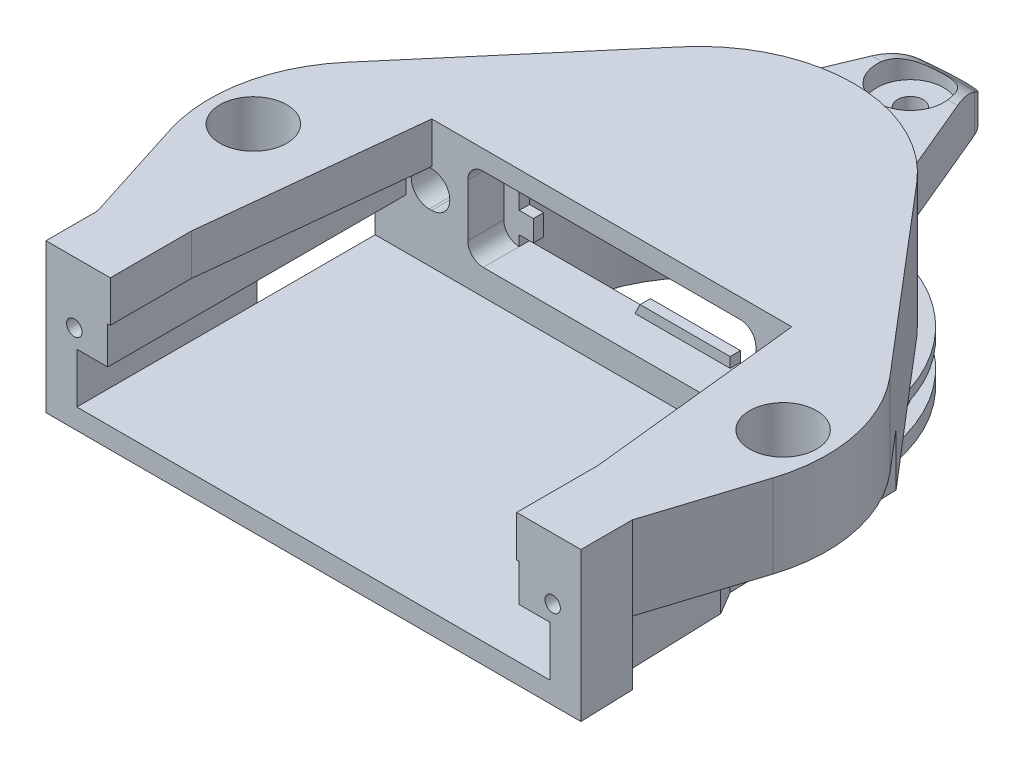
from build123d import *

# Parameters (mm, degrees)
TOP_SIDE_R                   = 0.5
BASE_MODEL_DEPTH             = 0.5
BOSS_EXTRUDE1_DEPTH          = 15
BOSS_EXTRUDE2_DEPTH          = 75
BOSS_EXTRUDE2_DEPTH_BACK     = 20
SKETCH9_W                    = 120
SKETCH9_H                    = 26
F_5_0_5_DIAMETER_HOLE1_D     = 5
CUT_EXTRUDE1_START           = 2.55
CUT_EXTRUDE1_DEPTH           = 21.3
CUT_EXTRUDE2_DEPTH           = 98.85991263
CUT_EXTRUDE2_DEPTH_BACK      = 9.8
CUT_EXTRUDE2_START           = 2.55
DRAFT11_START                = -48.5
DRAFT11_DEPTH                = 97
DRAFT11_START_2              = -52
DRAFT11_2_DEPTH              = 104
DRAFT11_START_3              = -9.867171929
DRAFT11_3_DEPTH              = 2.617171929
CUT_EXTRUDE5_START           = -18.75
CUT_EXTRUDE5_DEPTH           = 36
FILLET2_R                    = 10
CUT_EXTRUDE3_START           = 13.25
SKETCH12_R                   = 6.5
CUT_EXTRUDE3_DEPTH           = 4
CUT_EXTRUDE4_START           = 7.55
SKETCH14_R                   = 6.5
CUT_EXTRUDE4_DEPTH           = 11.2
CUT_EXTRUDE6_START           = -6.25
CUT_EXTRUDE6_DEPTH           = 25
CUT_EXTRUDE7_DEPTH           = 98.85991263
CUT_EXTRUDE7_DEPTH_BACK      = 7
CUT_EXTRUDE7_START           = 17
CUT_EXTRUDE8_START           = 17
CUT_EXTRUDE8_DEPTH           = 81.85991263
CUT_EXTRUDE9_START           = 8
CUT_EXTRUDE9_DEPTH           = 90.85991263
F_3_0_3_DIAMETER_HOLE1_D     = 3
F_3_0_3_DIAMETER_HOLE1_DEPTH = 15
F_3_0_3_DIAMETER_HOLE1_TIP   = 0.901290929


with BuildPart() as part:
    # Top Side → Base Model (new, symmetric)
    with BuildSketch(Plane(origin=(0, 0, 0), x_dir=(1, 0, 0), z_dir=(0, 1, 0))):
        with Locations(Location((0, 0, 0), (0, 0, 270))):
            Circle(TOP_SIDE_R)
    extrude(amount=BASE_MODEL_DEPTH, both=True)



with BuildPart() as body_2:
    # Sketch3 → Base (revolve)
    with BuildSketch(Plane(origin=(0, 0, 0), x_dir=(0, 0, -1), z_dir=(1, 0, 0))):
        Polygon((0, -18.75), (30, -18.75), (31.25, -17.25), (32.5, -17.25), (32.5, -14.25), (30, -14.25), (30, -9.25), (32.5, -9.25), (32.5, -7.25), (30, -7.25), (30, 18.75), (0, 18.75), align=None)
    revolve(axis=Axis((0, -18.75, 0), (0, 1, 0)))

    # Sketch8 → Boss-Extrude1 (add, symmetric)
    with BuildSketch(Plane(origin=(0, 0, 0), x_dir=(0, 0, -1), z_dir=(1, 0, 0))):
        Polygon((0, 4.25), (51.5, 4.25), (51.5, 8.25), (45.5, 13.25), (0, 13.25), align=None)
    extrude(amount=BOSS_EXTRUDE1_DEPTH, both=True)


with BuildPart() as part_1:
    add(part.part)

    add(body_2.part)  # Boss-Extrude2 merges body 2
    # Sketch9 → Boss-Extrude2 (add, two sides: drawn at the far end of the back side and taken through both)
    with BuildSketch(Plane.XY.offset(-BOSS_EXTRUDE2_DEPTH_BACK)):
        with Locations((0, 5.75)):
            Rectangle(SKETCH9_W, SKETCH9_H)
    extrude(amount=BOSS_EXTRUDE2_DEPTH + BOSS_EXTRUDE2_DEPTH_BACK)

    # Ø5.0 (5) Diameter Hole1 (through all)
    with Locations(Plane(origin=(0, 18.75, 0), x_dir=(1, 0, 0), z_dir=(0, 1, 0))):
        with Locations((-51.5, -35.2), (0, 41.034834557), (51.5, -35.2)):
            Hole(F_5_0_5_DIAMETER_HOLE1_D / 2)

    # Bottom Side Sketch5 → Cut-Extrude1 (cut)
    with BuildSketch(Plane(origin=(0, 0, 0), x_dir=(1, 0, 0), z_dir=(0, 1, 0)).offset(CUT_EXTRUDE1_START)):
        with BuildLine():
            Line((-25.617376915, 20), (-46, -6.107466904))
            Line((-46, -6.107466904), (-46, -40))
            Line((-46, -40), (-48.5, -44.330127019))
            Line((-48.5, -44.330127019), (-48.5, -65))
            Line((-48.5, -65), (-52, -65))
            Line((-52, -65), (-52, -116.5))
            Line((-52, -116.5), (-101.5, -116.5))
            Line((-101.5, -116.5), (-101.5, 101.5))
            Line((-101.5, 101.5), (101.5, 101.5))
            Line((101.5, 101.5), (101.5, -116.5))
            Line((101.5, -116.5), (52, -116.5))
            Line((52, -116.5), (52, -65))
            Line((52, -65), (48.5, -65))
            Line((48.5, -65), (48.5, -44.330127019))
            Line((48.5, -44.330127019), (46, -40))
            Line((46, -40), (46, -6.107466904))
            Line((46, -6.107466904), (25.617376915, 20))
            ThreePointArc((25.617376915, 20), (0, 32.5), (-25.617376915, 20))
        make_face()
    extrude(amount=-CUT_EXTRUDE1_DEPTH, mode=Mode.SUBTRACT)

    # Sketch11 → Cut-Extrude2 (cut, two sides: drawn at the far end of the back side and taken through both)
    with BuildSketch(Plane(origin=(0, 0, 0), x_dir=(1, 0, 0), z_dir=(0, 1, 0)).offset(CUT_EXTRUDE2_START - CUT_EXTRUDE2_DEPTH_BACK)):
        with BuildLine():
            Line((-52, -116.5), (-52, -65))
            Line((-52, -65), (-58.587704801, -44.296325315))
            ThreePointArc((-58.587704801, -44.296325315), (-59.408678786, -29.272976119), (-52.832552516, -15.740438196))
            Line((-52.832552516, -15.740438196), (-22.832552516, 19.459561804))
            ThreePointArc((-22.832552516, 19.459561804), (-19.195234326, 23.055215877), (-15, 25.980762114))
            Line((-15, 25.980762114), (-5.996666068, 47.507986456))
            ThreePointArc((-5.996666068, 47.507986456), (0, 51.5), (5.996666068, 47.507986456))
            Line((5.996666068, 47.507986456), (15, 25.980762114))
            ThreePointArc((15, 25.980762114), (19.195234326, 23.055215877), (22.832552516, 19.459561804))
            Line((22.832552516, 19.459561804), (52.832552516, -15.740438196))
            ThreePointArc((52.832552516, -15.740438196), (59.408678786, -29.272976119), (58.587704801, -44.296325315))
            Line((58.587704801, -44.296325315), (52, -65))
            Line((52, -65), (52, -116.5))
            Line((52, -116.5), (101.5, -116.5))
            Line((101.5, -116.5), (101.5, 101.5))
            Line((101.5, 101.5), (-101.5, 101.5))
            Line((-101.5, 101.5), (-101.5, -116.5))
            Line((-101.5, -116.5), (-52, -116.5))
        make_face()
    extrude(amount=CUT_EXTRUDE2_DEPTH + CUT_EXTRUDE2_DEPTH_BACK, mode=Mode.SUBTRACT)

    # Draft11: read off the stored shape, not the designer's step
    # Draft11 outline → Draft11 (add)
    with BuildSketch(Plane.YZ.offset(DRAFT11_START)):
        Polygon((-7.25, 75), (-10.216379624, 75), (-7.25, -9.945998255), align=None)
    extrude(amount=DRAFT11_DEPTH)

    # Draft11 2 outline → Draft11 2 (add)
    with BuildSketch(Plane.YZ.offset(DRAFT11_START_2)):
        Polygon((-7.25, 75), (-10.216379624, 75), (-9.867171929, 65), (-7.25, 65), align=None)
    extrude(amount=DRAFT11_2_DEPTH)

    # Draft11 3 outline → Draft11 3 (cut)
    with BuildSketch(Plane(origin=(0, 0, 0), x_dir=(1, 0, 0), z_dir=(0, 1, 0)).offset(DRAFT11_START_3)):
        Polygon((48.5, 9.945998255), (30.940703268, 9.945998255), (46, -7.723576577), (46, -40), (48.5, -44.330127019), align=None)
        Polygon((-30.940703268, 9.945998255), (-48.5, 9.945998255), (-48.5, -44.330127019), (-46, -40), (-46, -7.723576577), align=None)
    extrude(amount=DRAFT11_3_DEPTH, mode=Mode.SUBTRACT)

    # Sketch16 → Cut-Extrude5 (cut)
    with BuildSketch(Plane(origin=(0, 0, 0), x_dir=(1, 0, 0), z_dir=(0, 1, 0)).offset(CUT_EXTRUDE5_START)):
        with BuildLine():
            Line((-26.83281573, -8), (26.83281573, -8))
            ThreePointArc((26.83281573, -8), (0, 28), (-26.83281573, -8))
        make_face()
    extrude(amount=CUT_EXTRUDE5_DEPTH, mode=Mode.SUBTRACT)

    # Fillet2
    # the kernel refuses this fillet: 10 mm, written as the material it takes off along each edge
    with BuildSketch(Plane(origin=(15.887714893, 13.25, -45.5), x_dir=(0, 0, 1), z_dir=(-1, 0, 0))) as fillet2_piece_1:
        with BuildLine():
            CenterArc((FILLET2_R * 0.362049935181, -FILLET2_R), FILLET2_R, 90, 39.805571092)
            Line((-FILLET2_R * 0.278134464483, -FILLET2_R * 0.231778720403), (0, 0))
            Line((0, 0), (FILLET2_R * 0.362049935181, 0))
        make_face()
    extrude(amount=31.775429787, mode=Mode.SUBTRACT)

    # Sketch12 → Cut-Extrude3 (cut)
    with BuildSketch(Plane(origin=(0, 0, 0), x_dir=(1, 0, 0), z_dir=(0, 1, 0)).offset(CUT_EXTRUDE3_START)):
        with Locations(Location((0, 41.034834557, 0), (0, 0, 270))):
            Circle(SKETCH12_R)
    extrude(amount=-CUT_EXTRUDE3_DEPTH, mode=Mode.SUBTRACT)

    # Sketch14 → Cut-Extrude4 (cut)
    with BuildSketch(Plane(origin=(0, 0, 0), x_dir=(1, 0, 0), z_dir=(0, 1, 0)).offset(CUT_EXTRUDE4_START)):
        with Locations(Location((51.5, -35.2, 0), (0, 0, 270))):
            Circle(SKETCH14_R)
        with Locations(Location((-51.5, -35.2, 0), (0, 0, 270))):
            Circle(SKETCH14_R)
    extrude(amount=CUT_EXTRUDE4_DEPTH, mode=Mode.SUBTRACT)

    # Sketch19 → Cut-Extrude6 (cut)
    with BuildSketch(Plane(origin=(0, 0, 0), x_dir=(1, 0, 0), z_dir=(0, 1, 0)).offset(CUT_EXTRUDE6_START)):
        Polygon((35, -17), (-35, -17), (-39.5, -59.2), (-39.5, -116.5), (39.5, -116.5), (39.5, -59.2), align=None)
    extrude(amount=CUT_EXTRUDE6_DEPTH, mode=Mode.SUBTRACT)

    # Sketch20 → Cut-Extrude7 (cut, two sides: drawn at the far end of the back side and taken through both)
    with BuildSketch(Plane.XY.offset(CUT_EXTRUDE7_START - CUT_EXTRUDE7_DEPTH_BACK)):
        with BuildLine():
            Line((-25, 14.95), (25, 14.95))
            ThreePointArc((25, 14.95), (27.121320344, 14.071320344), (28, 11.95))
            Line((28, 11.95), (28, 1.75))
            ThreePointArc((28, 1.75), (27.121320344, -0.371320344), (25, -1.25))
            Line((25, -1.25), (-25, -1.25))
            ThreePointArc((-25, -1.25), (-27.121320344, -0.371320344), (-28, 1.75))
            Line((-28, 1.75), (-28, 11.95))
            ThreePointArc((-28, 11.95), (-27.121320344, 14.071320344), (-25, 14.95))
        make_face()
        with BuildLine():
            Line((-35.5, 10.35), (-35, 10.35))
            ThreePointArc((-35, 10.35), (-31.5, 6.85), (-35, 3.35))
            Line((-35, 3.35), (-35.5, 3.35))
            ThreePointArc((-35.5, 3.35), (-39, 6.85), (-35.5, 10.35))
        make_face()
        with BuildLine():
            Line((35.5, 10.35), (35, 10.35))
            ThreePointArc((35, 10.35), (31.5, 6.85), (35, 3.35))
            Line((35, 3.35), (35.5, 3.35))
            ThreePointArc((35.5, 3.35), (39, 6.85), (35.5, 10.35))
        make_face()
    extrude(amount=CUT_EXTRUDE7_DEPTH + CUT_EXTRUDE7_DEPTH_BACK, mode=Mode.SUBTRACT)

    # Sketch21 → Cut-Extrude8 (cut, through all)
    with BuildSketch(Plane.XY.offset(CUT_EXTRUDE8_START)):
        Polygon((35, 18.75), (35, 10.75), (40, 10.75), (40, 3.486117838), (46, 3.486117838), (46, -6.25), (-46, -6.25), (-46, 3.486117838), (-40, 3.486117838), (-40, 10.75), (-35, 10.75), (-35, 18.75), align=None)
    extrude(amount=CUT_EXTRUDE8_DEPTH, mode=Mode.SUBTRACT)

    # Sketch23 → Cut-Extrude9 (cut, through all)
    with BuildSketch(Plane.XY.offset(CUT_EXTRUDE9_START)):
        Polygon((-2.5, 14.95), (-25, 14.95), (-25, 12.95), (-22.25, 12.95), (-22.25, 8.85), (-25, 8.85), (-25, 4.85), (-22.25, 4.85), (-22.25, 0.75), (-25, 0.75), (-25, -1.25), (-2.5, -1.25), (-1.5, 0.75), (16, 0.75), (16, -1.25), (25, -1.25), (25, 0.75), (22.25, 0.75), (22.25, 4.85), (25, 4.85), (25, 8.85), (22.25, 8.85), (22.25, 12.95), (25, 12.95), (25, 14.95), (16, 14.95), (16, 10.75), (1.5, 10.75), (1.5, 11.95), (-1.5, 11.95), align=None)
    extrude(amount=CUT_EXTRUDE9_DEPTH, mode=Mode.SUBTRACT)

    # Ø3.0 (3) Diameter Hole1
    with Locations(Plane.XY.offset(75)):
        with Locations((-46.5, 6.85), (46.5, 6.85)):
            Hole(F_3_0_3_DIAMETER_HOLE1_D / 2, depth=F_3_0_3_DIAMETER_HOLE1_DEPTH)
            with Locations((0, 0, -(F_3_0_3_DIAMETER_HOLE1_DEPTH + F_3_0_3_DIAMETER_HOLE1_TIP / 2))):  # 118° drill point
                Cone(0, F_3_0_3_DIAMETER_HOLE1_D / 2, F_3_0_3_DIAMETER_HOLE1_TIP, mode=Mode.SUBTRACT)


solid = part_1.part
